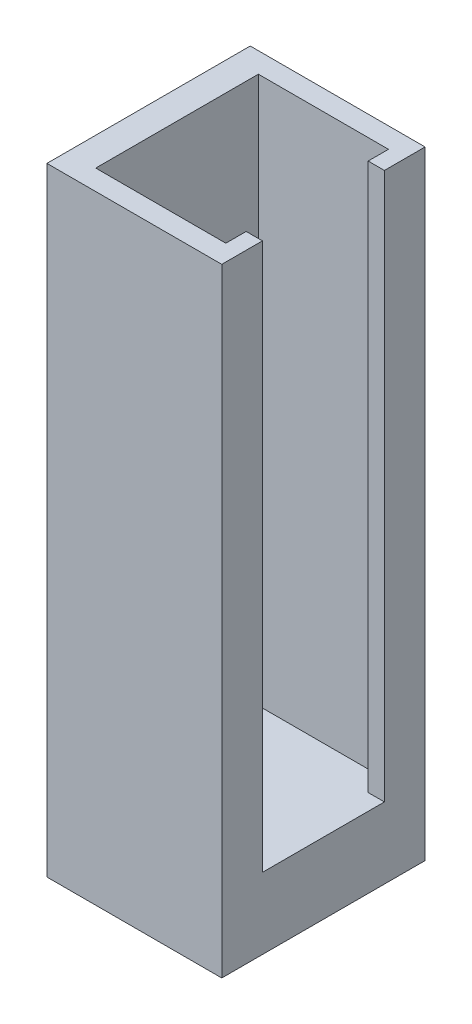
from build123d import *

# Parameters (mm, degrees)
SKETCH1_W           = 4.3
SKETCH1_H           = 15.2
BOSS_EXTRUDE1_DEPTH = 2.5
CUT_EXTRUDE1_START  = -1.75
CUT_EXTRUDE1_DEPTH  = 14.803536575


with BuildPart() as part:
    # Sketch1 → Boss-Extrude1 (new, symmetric)
    with BuildSketch(Plane.XY):
        with Locations((0, 7.6)):
            Rectangle(SKETCH1_W, SKETCH1_H)
    extrude(amount=BOSS_EXTRUDE1_DEPTH, both=True)

    # Sketch3 → Cut-Extrude1 (cut, through all)
    with BuildSketch(Plane(origin=(0, 0, 0), x_dir=(-1, 0, 0), z_dir=(0, -1, 0)).offset(CUT_EXTRUDE1_START)):
        Polygon((-2.15, -1.5), (-1.75, -1.5), (-1.75, -2), (1.45, -2), (1.45, 2), (-1.75, 2), (-1.75, 1.5), (-2.15, 1.5), align=None)
    extrude(amount=-CUT_EXTRUDE1_DEPTH, mode=Mode.SUBTRACT)


solid = part.part
